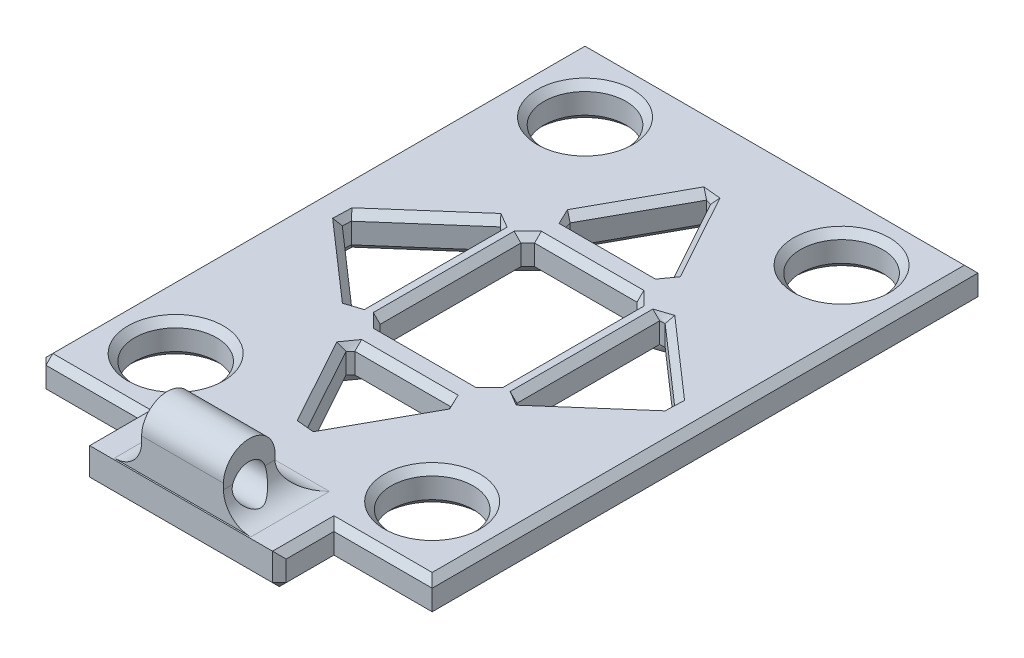
from build123d import *
from OCP.BRepFilletAPI import BRepFilletAPI_MakeChamfer

# Parameters (mm, degrees)
SKETCH1_W           = 36.576
SKETCH1_H           = 3.175
BOSS_EXTRUDE1_DEPTH = 25.4
SKETCH2_R           = 3.81
CUT_EXTRUDE3_DEPTH  = 32.459363773
SKETCH4_W           = 18.288
SKETCH4_H           = 3.175
BOSS_EXTRUDE2_DEPTH = 5.08
BOSS_EXTRUDE3_DEPTH = 3.81
SKETCH6_R           = 1.5875
CUT_EXTRUDE4_DEPTH  = 7.62
FILLET1_R           = 2.54
CHAMFER1_SIZE       = 0.635
SKETCH7_W           = 10.80479742
SKETCH7_H           = 14.370937622
CUT_EXTRUDE5_DEPTH  = 7.62
CHAMFER2_SIZE       = 0.635
CHAMFER2_SIZE2      = 0.565290244
CHAMFER2_SIZE2_2    = 0.449999452
CHAMFER2_SIZE2_3    = 0.467451402
CHAMFER2_SIZE2_4    = 0.46028724


with BuildPart() as part:
    # Sketch1 → Boss-Extrude1 (new, symmetric)
    with BuildSketch(Plane.XY):
        Rectangle(SKETCH1_W, SKETCH1_H)
    extrude(amount=BOSS_EXTRUDE1_DEPTH, both=True)

    # Sketch2 → Cut-Extrude3 (cut, through all)
    with BuildSketch(Plane(origin=(0, 1.5875, 0), x_dir=(1, 0, 0), z_dir=(0, 1, 0))):
        with Locations(Location((-11.938, 19.05, 0), (0, 0, 270))):
            Circle(SKETCH2_R)
        with Locations(Location((-11.938, -19.05, 0), (0, 0, 90))):
            Circle(SKETCH2_R)
        with Locations(Location((11.938, -19.05, 0), (0, 0, 270))):
            Circle(SKETCH2_R)
        with Locations(Location((11.938, 19.05, 0), (0, 0, 90))):
            Circle(SKETCH2_R)
    extrude(amount=-CUT_EXTRUDE3_DEPTH, mode=Mode.SUBTRACT)

    # Sketch4 → Boss-Extrude2 (add)
    with BuildSketch(Plane.XY.offset(25.4)):
        Rectangle(SKETCH4_W, SKETCH4_H)
    extrude(amount=BOSS_EXTRUDE2_DEPTH)

    # Sketch5 → Boss-Extrude3 (add, symmetric)
    with BuildSketch(Plane(origin=(0, 0, 0), x_dir=(0, 0, -1), z_dir=(1, 0, 0))):
        with BuildLine():
            Line((-30.344070504, 4.647366468), (-30.344070504, 1.5875))
            Line((-30.344070504, 1.5875), (-25.551463196, 1.5875))
            Line((-25.551463196, 1.5875), (-25.551463196, 4.647366468))
            ThreePointArc((-25.551463196, 4.647366468), (-27.94776685, 7.043670122), (-30.344070504, 4.647366468))
        make_face()
    extrude(amount=BOSS_EXTRUDE3_DEPTH, both=True)

    # Sketch6 → Cut-Extrude4 (cut)
    with BuildSketch(Plane(origin=(3.81, 0, 0), x_dir=(0, 0, -1), z_dir=(1, 0, 0))):
        with Locations((-27.980910855, 3.6195)):
            Circle(SKETCH6_R)
    extrude(amount=-CUT_EXTRUDE4_DEPTH, mode=Mode.SUBTRACT)

    # Fillet1
    # the kernel refuses this fillet: 2.54 mm, written as the material it adds along each edge
    with BuildSketch(Plane(origin=(-3.81, 1.5875, 30.344070504), x_dir=(-1, 0, 0), z_dir=(0, 0, -1))) as fillet1_piece_1_section:
        with BuildLine():
            CenterArc((FILLET1_R, FILLET1_R), FILLET1_R, 180, 90)
            Line((0, FILLET1_R), (-FILLET1_R * 0.02, FILLET1_R))
            Line((-FILLET1_R * 0.02, FILLET1_R), (-FILLET1_R * 0.02, -FILLET1_R * 0.02))
            Line((-FILLET1_R * 0.02, -FILLET1_R * 0.02), (FILLET1_R, -FILLET1_R * 0.02))
            Line((FILLET1_R, -FILLET1_R * 0.02), (FILLET1_R, 0))
        make_face()
    fillet1_piece_1 = extrude(amount=4.792607307, mode=Mode.PRIVATE)
    fillet1_piece_1 = fillet1_piece_1 - Plane(origin=(-4.483296525, 3.6195, 27.980910855), x_dir=(0, 0, -1), z_dir=(1, 0, 0)) * Cylinder(1.5875, 20, mode=Mode.PRIVATE)
    add(fillet1_piece_1)
    with BuildSketch(Plane(origin=(-3.81, 1.5875, 25.551463196), x_dir=(0, 0, -1), z_dir=(1, 0, 0))) as fillet1_piece_2:
        with BuildLine():
            CenterArc((FILLET1_R, FILLET1_R), FILLET1_R, 180, 90)
            Line((0, FILLET1_R), (-FILLET1_R * 0.02, FILLET1_R))
            Line((-FILLET1_R * 0.02, FILLET1_R), (-FILLET1_R * 0.02, -FILLET1_R * 0.02))
            Line((-FILLET1_R * 0.02, -FILLET1_R * 0.02), (FILLET1_R, -FILLET1_R * 0.02))
            Line((FILLET1_R, -FILLET1_R * 0.02), (FILLET1_R, 0))
        make_face()
    extrude(amount=7.62)
    with BuildSketch(Plane(origin=(3.81, 1.5875, 30.344070504), x_dir=(1, 0, 0), z_dir=(0, 0, -1))) as fillet1_piece_3_section:
        with BuildLine():
            CenterArc((FILLET1_R, -FILLET1_R), FILLET1_R, 90, 90)
            Line((0, -FILLET1_R), (-FILLET1_R * 0.02, -FILLET1_R))
            Line((-FILLET1_R * 0.02, -FILLET1_R), (-FILLET1_R * 0.02, FILLET1_R * 0.02))
            Line((-FILLET1_R * 0.02, FILLET1_R * 0.02), (FILLET1_R, FILLET1_R * 0.02))
            Line((FILLET1_R, FILLET1_R * 0.02), (FILLET1_R, 0))
        make_face()
    fillet1_piece_3 = extrude(amount=4.792607307, mode=Mode.PRIVATE)
    fillet1_piece_3 = fillet1_piece_3 - Plane(origin=(4.483296525, 3.6195, 27.980910855), x_dir=(0, 0, -1), z_dir=(1, 0, 0)) * Cylinder(1.5875, 20, mode=Mode.PRIVATE)
    add(fillet1_piece_3)
    with BuildSketch(Plane(origin=(-3.81, 1.5875, 30.344070504), x_dir=(-1, 0, 0), z_dir=(0, 0, -1))) as fillet1_piece_4a_section:
        with BuildLine():
            CenterArc((FILLET1_R, FILLET1_R), FILLET1_R, 180, 90)
            Line((0, FILLET1_R), (-FILLET1_R * 0.02, FILLET1_R))
            Line((-FILLET1_R * 0.02, FILLET1_R), (-FILLET1_R * 0.02, -FILLET1_R * 0.02))
            Line((-FILLET1_R * 0.02, -FILLET1_R * 0.02), (FILLET1_R, -FILLET1_R * 0.02))
            Line((FILLET1_R, -FILLET1_R * 0.02), (FILLET1_R, 0))
        make_face()
    fillet1_piece_4a = extrude(amount=7.332607307, mode=Mode.PRIVATE)
    fillet1_piece_4a = split(fillet1_piece_4a, bisect_by=Plane(origin=(-4.38504359, 2.16254359, 25.551463196), z_dir=(0, 0, -1)), keep=Keep.TOP, mode=Mode.PRIVATE)
    with BuildSketch(Plane(origin=(-6.35, 1.5875, 25.551463196), x_dir=(0, 0, -1), z_dir=(1, 0, 0))) as fillet1_piece_4b_section:
        with BuildLine():
            CenterArc((FILLET1_R, FILLET1_R), FILLET1_R, 180, 90)
            Line((0, FILLET1_R), (-FILLET1_R * 0.02, FILLET1_R))
            Line((-FILLET1_R * 0.02, FILLET1_R), (-FILLET1_R * 0.02, -FILLET1_R * 0.02))
            Line((-FILLET1_R * 0.02, -FILLET1_R * 0.02), (FILLET1_R, -FILLET1_R * 0.02))
            Line((FILLET1_R, -FILLET1_R * 0.02), (FILLET1_R, 0))
        make_face()
    fillet1_piece_4b = extrude(amount=10.16, mode=Mode.PRIVATE)
    fillet1_piece_4b = split(fillet1_piece_4b, bisect_by=Plane(origin=(-3.81, 2.16254359, 24.976419606), z_dir=(-1, 0, 0)), keep=Keep.TOP, mode=Mode.PRIVATE)
    fillet1_piece_4 = fillet1_piece_4a & fillet1_piece_4b
    add(fillet1_piece_4)
    with BuildSketch(Plane(origin=(-3.81, 1.5875, 25.551463196), x_dir=(0, 0, -1), z_dir=(1, 0, 0))) as fillet1_piece_5a_section:
        with BuildLine():
            CenterArc((FILLET1_R, FILLET1_R), FILLET1_R, 180, 90)
            Line((0, FILLET1_R), (-FILLET1_R * 0.02, FILLET1_R))
            Line((-FILLET1_R * 0.02, FILLET1_R), (-FILLET1_R * 0.02, -FILLET1_R * 0.02))
            Line((-FILLET1_R * 0.02, -FILLET1_R * 0.02), (FILLET1_R, -FILLET1_R * 0.02))
            Line((FILLET1_R, -FILLET1_R * 0.02), (FILLET1_R, 0))
        make_face()
    fillet1_piece_5a = extrude(amount=10.16, mode=Mode.PRIVATE)
    fillet1_piece_5a = split(fillet1_piece_5a, bisect_by=Plane(origin=(3.81, 2.16254359, 24.976419606), z_dir=(1, 0, 0)), keep=Keep.TOP, mode=Mode.PRIVATE)
    with BuildSketch(Plane(origin=(3.81, 1.5875, 30.344070504), x_dir=(1, 0, 0), z_dir=(0, 0, -1))) as fillet1_piece_5b_section:
        with BuildLine():
            CenterArc((FILLET1_R, -FILLET1_R), FILLET1_R, 90, 90)
            Line((0, -FILLET1_R), (-FILLET1_R * 0.02, -FILLET1_R))
            Line((-FILLET1_R * 0.02, -FILLET1_R), (-FILLET1_R * 0.02, FILLET1_R * 0.02))
            Line((-FILLET1_R * 0.02, FILLET1_R * 0.02), (FILLET1_R, FILLET1_R * 0.02))
            Line((FILLET1_R, FILLET1_R * 0.02), (FILLET1_R, 0))
        make_face()
    fillet1_piece_5b = extrude(amount=7.332607307, mode=Mode.PRIVATE)
    fillet1_piece_5b = split(fillet1_piece_5b, bisect_by=Plane(origin=(4.38504359, 2.16254359, 25.551463196), z_dir=(0, 0, -1)), keep=Keep.TOP, mode=Mode.PRIVATE)
    fillet1_piece_5 = fillet1_piece_5a & fillet1_piece_5b
    add(fillet1_piece_5)

    # Chamfer1
    chamfer1_edges = [part.edges().sort_by_distance(p)[0] for p in [
        (-18.288, 0, 25.4),
        (-13.716, -1.5875, 25.4),
        (11.938, -1.5875, 15.24),
        (11.938, 1.5875, 15.24),
        (-11.938, -1.5875, -22.86),
        (-11.938, 1.5875, -22.86),
        (11.938, 1.5875, -15.24),
        (11.938, -1.5875, -15.24),
        (-11.938, 1.5875, 22.86),
        (-11.938, -1.5875, 22.86),
        (-13.716, 1.5875, 25.4),
        (13.716, -1.5875, 25.4),
        (9.144, 0, 30.48),
        (9.144, -1.5875, 27.94),
        (9.144, 1.5875, 27.94),
        (-9.144, 1.5875, 27.94),
        (-9.144, -1.5875, 27.94),
        (-9.144, 0, 30.48),
        (0, -1.5875, 30.48),
        (0, -1.5875, -25.4),
        (0, 1.5875, -25.4),
        (18.288, -1.5875, 0),
        (-18.288, -1.5875, 0),
        (-18.288, 1.5875, 0),
        (18.288, 1.5875, 0),
        (13.716, 1.5875, 25.4),
    ]]
    chamfer(chamfer1_edges, length=CHAMFER1_SIZE)

    # Sketch7 → Cut-Extrude5 (cut)
    with BuildSketch(Plane(origin=(0, 1.5875, 0), x_dir=(1, 0, 0), z_dir=(0, 1, 0))):
        Rectangle(SKETCH7_W, SKETCH7_H)
        Polygon((-7.325854507, 7.185468811), (-15.532253748, 0), (-7.325854507, -7.185468811), align=None)
        Polygon((5.040340334, -9.905849478), (0, -19.053850731), (-5.040340334, -9.905849478), align=None)
        Polygon((7.325854507, -7.185468811), (7.325854507, 7.185468811), (15.532253748, 0), align=None)
        Polygon((0, 19.053850731), (5.040340334, 9.905849478), (-5.040340334, 9.905849478), align=None)
    extrude(amount=-CUT_EXTRUDE5_DEPTH, mode=Mode.SUBTRACT)

    # Chamfer2: one chamfer whose edges measure the first distance from different faces: ONE call of the kernel's chamfer builder (chamfer() names one face for all edges)
    chamfer2_edges_1 = [part.edges().sort_by_distance(p)[0] for p in [
        (0, -1.5875, 7.185468811),
        (5.40239871, -1.5875, 0),
        (0, -1.5875, -7.185468811),
        (-5.40239871, -1.5875, 0),
        (-2.520170167, -1.5875, -14.479850105),
        (0, -1.5875, -9.905849478),
        (2.520170167, -1.5875, -14.479850105),
        (11.429054128, -1.5875, 3.592734405),
        (11.429054128, -1.5875, -3.592734405),
        (7.325854507, -1.5875, 0),
        (0, -1.5875, 9.905849478),
        (-2.520170167, -1.5875, 14.479850105),
        (2.520170167, -1.5875, 14.479850105),
        (-11.429054128, -1.5875, 3.592734405),
        (-7.325854507, -1.5875, 0),
        (-11.429054128, -1.5875, -3.592734405),
        (-11.429054128, 1.5875, -3.592734405),
        (-11.429054128, 1.5875, 3.592734405),
        (-7.325854507, 1.5875, 0),
        (2.520170167, 1.5875, 14.479850105),
        (0, 1.5875, 9.905849478),
        (-2.520170167, 1.5875, 14.479850105),
        (7.325854507, 1.5875, 0),
        (11.429054128, 1.5875, -3.592734405),
        (11.429054128, 1.5875, 3.592734405),
        (2.520170167, 1.5875, -14.479850105),
        (0, 1.5875, -9.905849478),
        (-2.520170167, 1.5875, -14.479850105),
        (-5.40239871, 0, 7.185468811),
        (-5.40239871, 1.5875, 0),
        (-5.40239871, 0, -7.185468811),
        (5.40239871, 0, -7.185468811),
        (5.40239871, 0, 7.185468811),
        (0, 1.5875, 7.185468811),
        (5.40239871, 1.5875, 0),
        (0, 1.5875, -7.185468811),
    ]]
    chamfer2_edges_2 = [part.edges().sort_by_distance(p)[0] for p in [
        (-15.532253748, 0, 0),
    ]]
    chamfer2_side_2 = [part.faces().sort_by_distance(p)[0] for p in [
        (-11.429054128, 0, -3.592734405),
    ]]
    chamfer2_edges_3 = [part.edges().sort_by_distance(p)[0] for p in [
        (-7.325854507, 0, -7.185468811),
    ]]
    chamfer2_side_3 = [part.faces().sort_by_distance(p)[0] for p in [
        (-7.325854507, 0, 0),
    ]]
    chamfer2_edges_4 = [part.edges().sort_by_distance(p)[0] for p in [
        (-7.325854507, 0, 7.185468811),
    ]]
    chamfer2_side_4 = [part.faces().sort_by_distance(p)[0] for p in [
        (-11.429054128, 0, 3.592734405),
    ]]
    chamfer2_edges_5 = [part.edges().sort_by_distance(p)[0] for p in [
        (5.040340334, 0, 9.905849478),
    ]]
    chamfer2_side_5 = [part.faces().sort_by_distance(p)[0] for p in [
        (2.520170167, 0, 14.479850105),
    ]]
    chamfer2_edges_6 = [part.edges().sort_by_distance(p)[0] for p in [
        (0, 0, 19.053850731),
    ]]
    chamfer2_side_6 = [part.faces().sort_by_distance(p)[0] for p in [
        (-2.520170167, 0, 14.479850105),
    ]]
    chamfer2_edges_7 = [part.edges().sort_by_distance(p)[0] for p in [
        (-5.040340334, 0, 9.905849478),
    ]]
    chamfer2_side_7 = [part.faces().sort_by_distance(p)[0] for p in [
        (0, 0, 9.905849478),
    ]]
    chamfer2_edges_8 = [part.edges().sort_by_distance(p)[0] for p in [
        (7.325854507, 0, 7.185468811),
    ]]
    chamfer2_side_8 = [part.faces().sort_by_distance(p)[0] for p in [
        (7.325854507, 0, 0),
    ]]
    chamfer2_edges_9 = [part.edges().sort_by_distance(p)[0] for p in [
        (7.325854507, 0, -7.185468811),
    ]]
    chamfer2_side_9 = [part.faces().sort_by_distance(p)[0] for p in [
        (11.429054128, 0, -3.592734405),
    ]]
    chamfer2_edges_10 = [part.edges().sort_by_distance(p)[0] for p in [
        (15.532253748, 0, 0),
    ]]
    chamfer2_side_10 = [part.faces().sort_by_distance(p)[0] for p in [
        (11.429054128, 0, 3.592734405),
    ]]
    chamfer2_edges_11 = [part.edges().sort_by_distance(p)[0] for p in [
        (0, 0, -19.053850731),
    ]]
    chamfer2_side_11 = [part.faces().sort_by_distance(p)[0] for p in [
        (2.520170167, 0, -14.479850105),
    ]]
    chamfer2_edges_12 = [part.edges().sort_by_distance(p)[0] for p in [
        (5.040340334, 0, -9.905849478),
    ]]
    chamfer2_side_12 = [part.faces().sort_by_distance(p)[0] for p in [
        (0, 0, -9.905849478),
    ]]
    chamfer2_edges_13 = [part.edges().sort_by_distance(p)[0] for p in [
        (-5.040340334, 0, -9.905849478),
    ]]
    chamfer2_side_13 = [part.faces().sort_by_distance(p)[0] for p in [
        (-2.520170167, 0, -14.479850105),
    ]]
    chamfer2 = BRepFilletAPI_MakeChamfer(part.part.solid().wrapped)
    for e in chamfer2_edges_1:
        chamfer2.Add(CHAMFER2_SIZE, e.wrapped)
    for e in chamfer2_edges_2:
        chamfer2.Add(CHAMFER2_SIZE, CHAMFER2_SIZE2, e.wrapped, chamfer2_side_2[0].wrapped)  # the first distance lies on this face
    for e in chamfer2_edges_3:
        chamfer2.Add(CHAMFER2_SIZE, CHAMFER2_SIZE2_2, e.wrapped, chamfer2_side_3[0].wrapped)  # the first distance lies on this face
    for e in chamfer2_edges_4:
        chamfer2.Add(CHAMFER2_SIZE, CHAMFER2_SIZE2_2, e.wrapped, chamfer2_side_4[0].wrapped)  # the first distance lies on this face
    for e in chamfer2_edges_5:
        chamfer2.Add(CHAMFER2_SIZE, CHAMFER2_SIZE2_3, e.wrapped, chamfer2_side_5[0].wrapped)  # the first distance lies on this face
    for e in chamfer2_edges_6:
        chamfer2.Add(CHAMFER2_SIZE, CHAMFER2_SIZE2_4, e.wrapped, chamfer2_side_6[0].wrapped)  # the first distance lies on this face
    for e in chamfer2_edges_7:
        chamfer2.Add(CHAMFER2_SIZE, CHAMFER2_SIZE2_3, e.wrapped, chamfer2_side_7[0].wrapped)  # the first distance lies on this face
    for e in chamfer2_edges_8:
        chamfer2.Add(CHAMFER2_SIZE, CHAMFER2_SIZE2_2, e.wrapped, chamfer2_side_8[0].wrapped)  # the first distance lies on this face
    for e in chamfer2_edges_9:
        chamfer2.Add(CHAMFER2_SIZE, CHAMFER2_SIZE2_2, e.wrapped, chamfer2_side_9[0].wrapped)  # the first distance lies on this face
    for e in chamfer2_edges_10:
        chamfer2.Add(CHAMFER2_SIZE, CHAMFER2_SIZE2, e.wrapped, chamfer2_side_10[0].wrapped)  # the first distance lies on this face
    for e in chamfer2_edges_11:
        chamfer2.Add(CHAMFER2_SIZE, CHAMFER2_SIZE2_4, e.wrapped, chamfer2_side_11[0].wrapped)  # the first distance lies on this face
    for e in chamfer2_edges_12:
        chamfer2.Add(CHAMFER2_SIZE, CHAMFER2_SIZE2_3, e.wrapped, chamfer2_side_12[0].wrapped)  # the first distance lies on this face
    for e in chamfer2_edges_13:
        chamfer2.Add(CHAMFER2_SIZE, CHAMFER2_SIZE2_3, e.wrapped, chamfer2_side_13[0].wrapped)  # the first distance lies on this face
    add(Compound.cast(chamfer2.Shape()), mode=Mode.REPLACE)


solid = part.part
